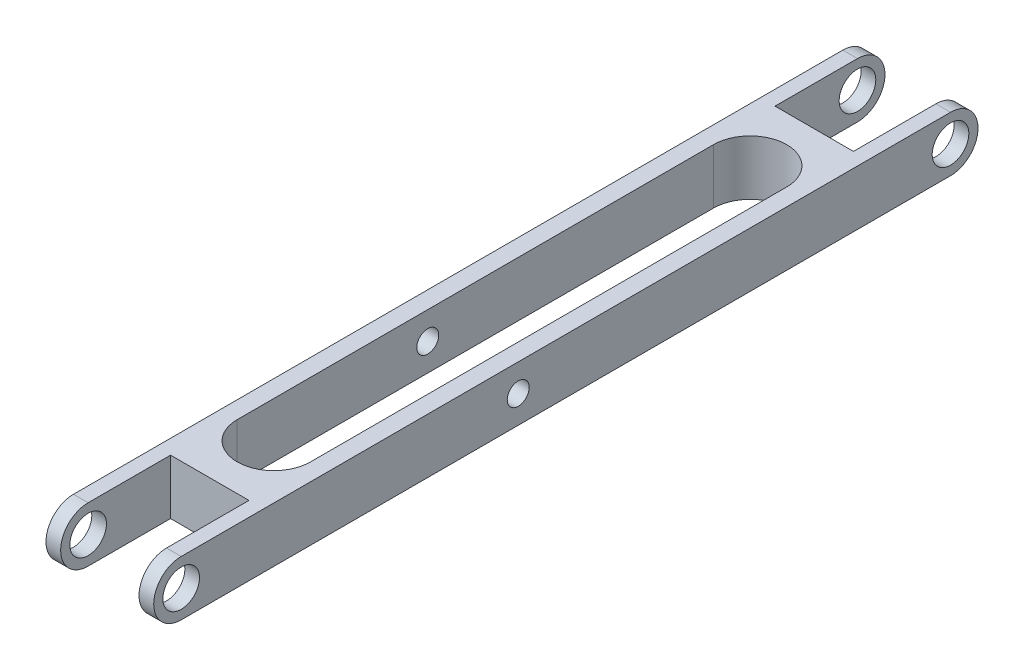
from build123d import *

# Parameters (mm, degrees)
EXTRUDE_1_DEPTH     = 29.4
SKETCH_3_W          = 21.4
SKETCH_3_H          = 30
CUT_EXTRUDE_1_DEPTH = 118.241673478
SKETCH_4_R          = 5
CUT_EXTRUDE_2_DEPTH = 117.519783728
CUT_EXTRUDE_3_DEPTH = 118.241673478
SKETCH_6_R          = 3
CUT_EXTRUDE_4_DEPTH = 117.519783728


with BuildPart() as part:
    # 草图2 → 凸台-拉伸1 (new body)
    with BuildSketch(Plane(origin=(0, 0, 0), x_dir=(0, 0, -1), z_dir=(1, 0, 0))):
        with BuildLine():
            Line((-105, -7.5), (105, -7.5))
            ThreePointArc((105, -7.5), (112.5, 0), (105, 7.5))
            Line((105, 7.5), (-105, 7.5))
            ThreePointArc((-105, 7.5), (-112.5, 0), (-105, -7.5))
        make_face()
    extrude(amount=EXTRUDE_1_DEPTH)

    # 草图3 → 切除-拉伸1 (cut, through all)
    with BuildSketch(Plane(origin=(0, 7.5, 0), x_dir=(1, 0, 0), z_dir=(0, 1, 0))):
        with Locations((14.7, -97.5)):
            Rectangle(SKETCH_3_W, SKETCH_3_H)
        with Locations((14.7, 97.5)):
            Rectangle(SKETCH_3_W, SKETCH_3_H)
    extrude(amount=-CUT_EXTRUDE_1_DEPTH, mode=Mode.SUBTRACT)

    # 草图4 → 切除-拉伸2 (cut, through all)
    with BuildSketch(Plane(origin=(29.4, 0, 0), x_dir=(0, 0, -1), z_dir=(1, 0, 0))):
        with Locations((-105, 0)):
            Circle(SKETCH_4_R)
        with Locations((105, 0)):
            Circle(SKETCH_4_R)
    extrude(amount=-CUT_EXTRUDE_2_DEPTH, mode=Mode.SUBTRACT)

    # 草图5 → 切除-拉伸3 (cut, through all)
    with BuildSketch(Plane.XZ.offset(7.5)):
        with BuildLine():
            Line((24.7, 65), (24.7, -65))
            ThreePointArc((24.7, -65), (14.7, -75), (4.7, -65))
            Line((4.7, -65), (4.7, 65))
            ThreePointArc((4.7, 65), (14.7, 75), (24.7, 65))
        make_face()
    extrude(amount=-CUT_EXTRUDE_3_DEPTH, mode=Mode.SUBTRACT)

    # 草图6 → 切除-拉伸4 (cut, through all)
    with BuildSketch(Plane.ZY):
        with Locations((13, 0)):
            Circle(SKETCH_6_R)
    extrude(amount=-CUT_EXTRUDE_4_DEPTH, mode=Mode.SUBTRACT)


solid = part.part
